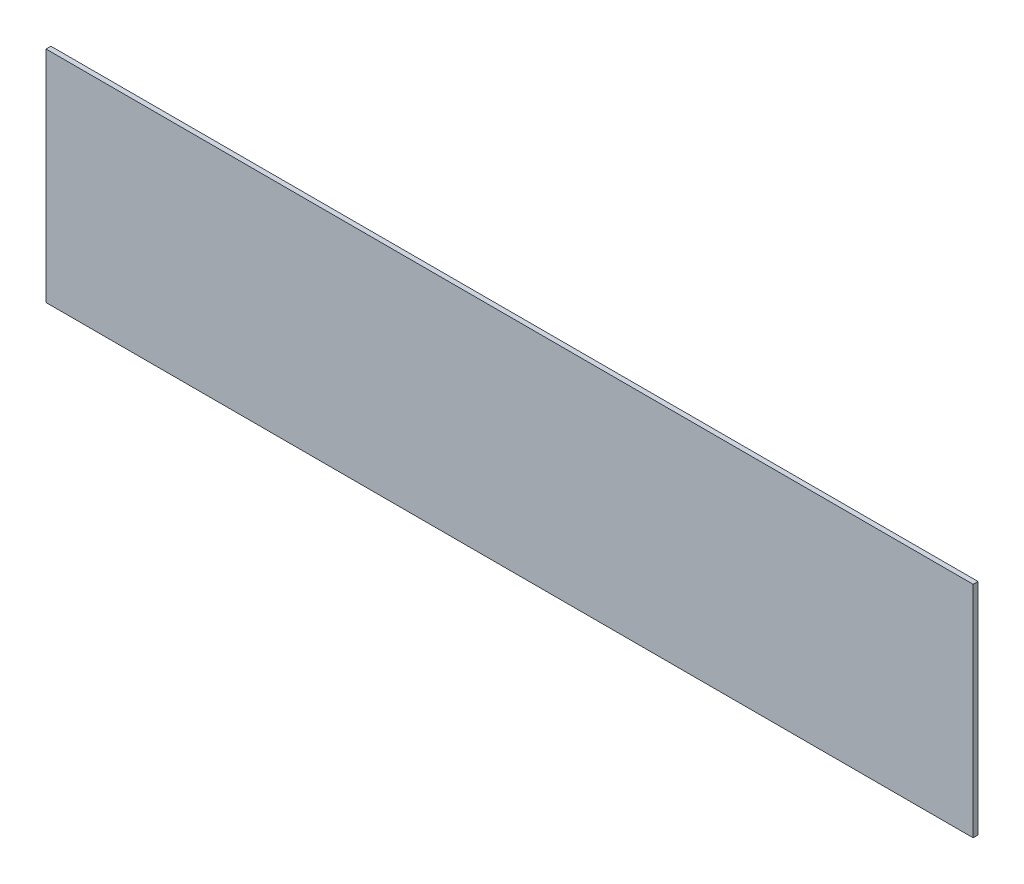
from build123d import *

# Parameters (mm, degrees)
SKETCH2_W           = 2
SKETCH2_H           = 90
BOSS_EXTRUDE1_DEPTH = 380


with BuildPart() as part:
    # Sketch2 → Boss-Extrude1 (new body)
    with BuildSketch(Plane(origin=(0, 0, 0), x_dir=(0, 0, -1), z_dir=(1, 0, 0))):
        with Locations((1, 45)):
            Rectangle(SKETCH2_W, SKETCH2_H)
    extrude(amount=BOSS_EXTRUDE1_DEPTH)


solid = part.part
